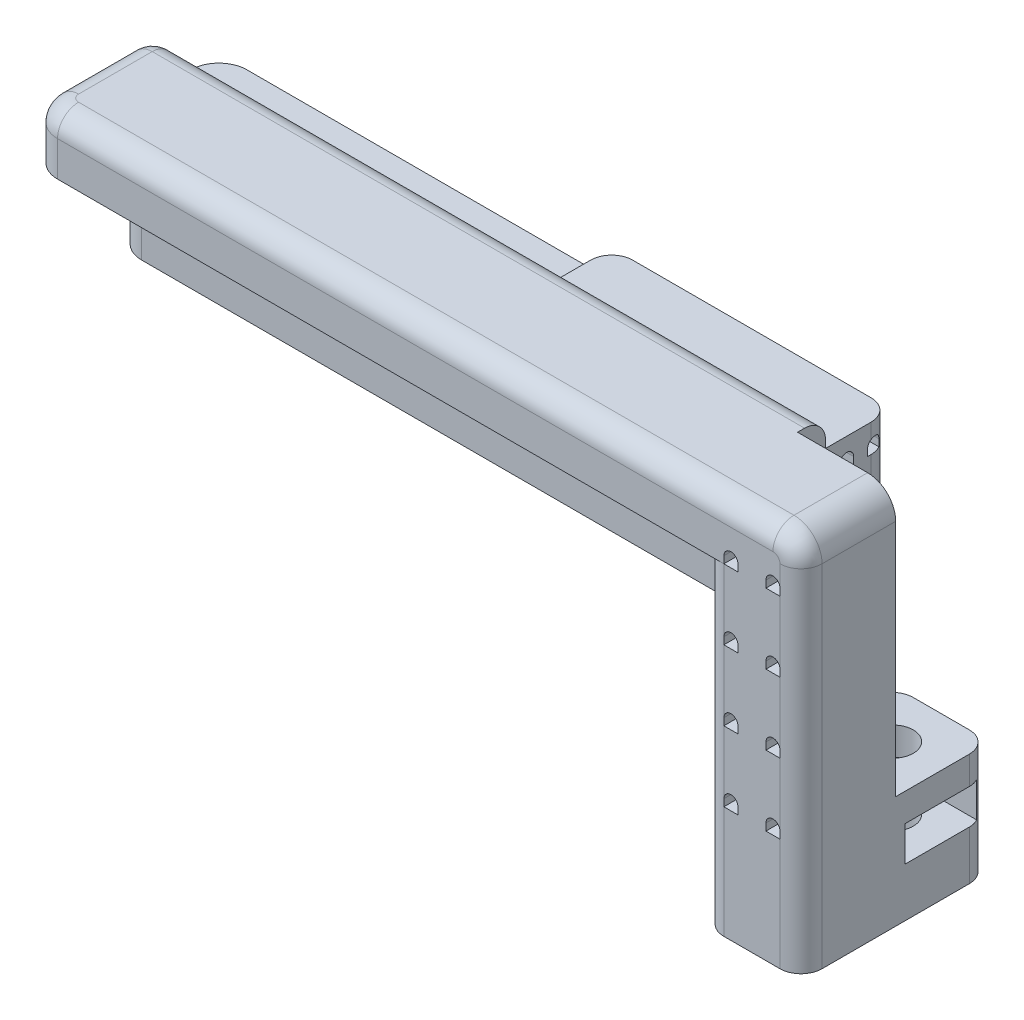
from build123d import *

# Parameters (mm, degrees)
SKETCH1_W            = 55
SKETCH1_H            = 16
BOSS_EXTRUDE1_DEPTH  = 4
SKETCH2_W            = 50
SKETCH2_H            = 8
BOSS_EXTRUDE2_DEPTH  = 8
SKETCH3_W            = 5
SKETCH3_H            = 16
BOSS_EXTRUDE3_DEPTH  = 28
SKETCH4_R            = 1.45
CUT_EXTRUDE2_DEPTH   = 10
CUT_EXTRUDE4_START   = -3
CUT_EXTRUDE4_DEPTH   = 3
CUT_EXTRUDE5_DEPTH   = 5
SKETCH8_W            = 50
SKETCH8_H            = 2
CUT_EXTRUDE6_DEPTH   = 4
CUT_EXTRUDE7_START   = -50
SKETCH9_W            = 0.5
SKETCH9_H            = 8
CUT_EXTRUDE7_DEPTH   = 50
CUT_EXTRUDE8_START   = -55
SKETCH10_W           = 0.5
SKETCH10_H           = 32
CUT_EXTRUDE8_DEPTH   = 55
CUT_EXTRUDE9_DEPTH   = 3
CUT_EXTRUDE11_DEPTH  = 3
BOSS_EXTRUDE4_START  = 2
SKETCH17_W           = 15
SKETCH17_H           = 32
BOSS_EXTRUDE4_DEPTH  = 2
CUT_EXTRUDE12_START  = -32
SKETCH18_W           = 7
SKETCH18_H           = 1.5
CUT_EXTRUDE12_DEPTH  = 32
FILLET1_R            = 2
SKETCH19_W           = 13.5
SKETCH19_H           = 32
CUT_EXTRUDE13_DEPTH  = 7
SKETCH20_W           = 7
SKETCH20_H           = 13.5
BOSS_EXTRUDE5_DEPTH  = 32
CUT_EXTRUDE14_DEPTH  = 13.5
FILLET2_R            = 2
CUT_EXTRUDE15_REACH  = 65.285
SKETCH22_W           = 6.75
SKETCH22_H           = 32
LPATTERN1_COUNT      = 4
LPATTERN1_PITCH      = 5
SKETCH23_W           = 4.75
SKETCH23_H           = 4
CUT_EXTRUDE16_DEPTH  = 48
BOSS_EXTRUDE9_START  = -15
SKETCH29_W           = 7
SKETCH29_H           = 6.75
SKETCH29_R           = 1.45
BOSS_EXTRUDE9_DEPTH  = 8
CUT_EXTRUDE19_START  = -2
CUT_EXTRUDE19_DEPTH  = 2.5
BOSS_EXTRUDE11_DEPTH = 20
SKETCH35_W           = 7
SKETCH35_H           = 5
CUT_EXTRUDE20_DEPTH  = 6.75
FILLET3_R            = 1.5


# Read off the part's stored shape, not the designer's step: Cut-Extrude4
with BuildPart() as part:
    # Sketch1 → Boss-Extrude1 (new body)
    with BuildSketch(Plane(origin=(0, 0, 0), x_dir=(1, 0, 0), z_dir=(0, 1, 0))):
        with Locations((27.5, 8)):
            Rectangle(SKETCH1_W, SKETCH1_H)
    extrude(amount=BOSS_EXTRUDE1_DEPTH)

    # Sketch2 → Boss-Extrude2 (add)
    with BuildSketch(Plane.XZ):
        with Locations((25, -10)):
            Rectangle(SKETCH2_W, SKETCH2_H)
    extrude(amount=BOSS_EXTRUDE2_DEPTH)

    # Sketch3 → Boss-Extrude3 (add)
    with BuildSketch(Plane.XZ):
        with Locations((52.5, -8)):
            Rectangle(SKETCH3_W, SKETCH3_H)
    extrude(amount=BOSS_EXTRUDE3_DEPTH)

    # Sketch4 → Cut-Extrude2 (cut)
    with BuildSketch(Plane.XY.offset(-6)):
        with Locations((10, -4)):
            Circle(SKETCH4_R)
        with Locations((20, -4)):
            Circle(SKETCH4_R)
        with Locations((30, -4)):
            Circle(SKETCH4_R)
        with Locations((40, -4)):
            Circle(SKETCH4_R)
    extrude(amount=-CUT_EXTRUDE2_DEPTH, mode=Mode.SUBTRACT)

    # Cut-Extrude4 outline → Cut-Extrude4 (cut)
    with BuildSketch(Plane.ZY.offset(-50).offset(CUT_EXTRUDE4_START)):
        Polygon((-6.598076211, -25.5), (-4, -27), (-1.401923789, -25.5), (-1.401923789, 0), (-6, 0), (-6, -8), (-6.598076211, -8), align=None)
        Polygon((-7.401923789, -25.5), (-7.401923789, -8), (-12.598076211, -8), (-12.598076211, -25.5), (-10, -27), align=None)
    extrude(amount=CUT_EXTRUDE4_DEPTH, mode=Mode.SUBTRACT)

    # Sketch7 → Cut-Extrude5 (cut)
    with BuildSketch(Plane.ZY.offset(-50)):
        with BuildLine():
            Line((-11.45, -12), (-11.45, -24))
            ThreePointArc((-11.45, -24), (-10, -25.45), (-8.55, -24))
            Line((-8.55, -24), (-8.55, -12))
            ThreePointArc((-8.55, -12), (-10, -10.55), (-11.45, -12))
        make_face()
        with BuildLine():
            Line((-2.55, -12), (-2.55, -24))
            ThreePointArc((-2.55, -24), (-4, -25.45), (-5.45, -24))
            Line((-5.45, -24), (-5.45, -12))
            ThreePointArc((-5.45, -12), (-4, -10.55), (-2.55, -12))
        make_face()
    extrude(amount=-CUT_EXTRUDE5_DEPTH, mode=Mode.SUBTRACT)

    # Sketch8 → Cut-Extrude6 (cut)
    with BuildSketch(Plane(origin=(0, 4, 0), x_dir=(1, 0, 0), z_dir=(0, 1, 0))):
        with Locations((25, 15)):
            Rectangle(SKETCH8_W, SKETCH8_H)
    extrude(amount=-CUT_EXTRUDE6_DEPTH, mode=Mode.SUBTRACT)

    # Sketch9 → Cut-Extrude7 (cut)
    with BuildSketch(Plane.ZY.offset(CUT_EXTRUDE7_START)):
        with Locations((-6.25, -4)):
            Rectangle(SKETCH9_W, SKETCH9_H)
    extrude(amount=CUT_EXTRUDE7_DEPTH, mode=Mode.SUBTRACT)

    # Sketch10 → Cut-Extrude8 (cut)
    with BuildSketch(Plane.ZY.offset(CUT_EXTRUDE8_START)):
        with Locations((-0.25, -12)):
            Rectangle(SKETCH10_W, SKETCH10_H)
        with Locations((-15.75, -12)):
            Rectangle(SKETCH10_W, SKETCH10_H)
    extrude(amount=CUT_EXTRUDE8_DEPTH, mode=Mode.SUBTRACT)

    # Sketch11 → Cut-Extrude9 (cut)
    with BuildSketch(Plane(origin=(0, 0, -14), x_dir=(-1, 0, 0), z_dir=(0, 0, -1))):
        Polygon((-37, -4), (-38.5, -1.401923789), (-41.5, -1.401923789), (-43, -4), (-41.5, -6.598076211), (-38.5, -6.598076211), align=None)
        Polygon((-27, -4), (-28.5, -1.401923789), (-31.5, -1.401923789), (-33, -4), (-31.5, -6.598076211), (-28.5, -6.598076211), align=None)
        Polygon((-17, -4), (-18.5, -1.401923789), (-21.5, -1.401923789), (-23, -4), (-21.5, -6.598076211), (-18.5, -6.598076211), align=None)
        Polygon((-7, -4), (-8.5, -1.401923789), (-11.5, -1.401923789), (-13, -4), (-11.5, -6.598076211), (-8.5, -6.598076211), align=None)
    extrude(amount=-CUT_EXTRUDE9_DEPTH, mode=Mode.SUBTRACT)

    # Sketch15 → Cut-Extrude11 (cut)
    with BuildSketch(Plane.ZY.offset(-50)):
        Polygon((-4, -27), (-1.401923789, -25.5), (-1.401923789, 0.004821093), (-1.401923789, 4), (-6.598076211, 4), (-6.598076211, -8), (-6.598076211, -25.5), align=None)
        Polygon((-7.401923789, -25.5), (-7.401923789, -8), (-7.401923789, 4), (-12.598076211, 4), (-12.598076211, -8), (-12.598076211, -25.5), (-10, -27), align=None)
    extrude(amount=-CUT_EXTRUDE11_DEPTH, mode=Mode.SUBTRACT)

    # Sketch17 → Boss-Extrude4 (add)
    with BuildSketch(Plane.ZY.offset(-50).offset(BOSS_EXTRUDE4_START)):
        with Locations((-8, -12)):
            Rectangle(SKETCH17_W, SKETCH17_H)
        with BuildLine():
            Line((-11.45, -12), (-11.45, -24))
            ThreePointArc((-11.45, -24), (-10, -25.45), (-8.55, -24))
            Line((-8.55, -24), (-8.55, -12))
            ThreePointArc((-8.55, -12), (-10, -10.55), (-11.45, -12))
        make_face(mode=Mode.SUBTRACT)
        with BuildLine():
            Line((-5.45, -12), (-5.45, -24))
            ThreePointArc((-5.45, -24), (-4, -25.45), (-2.55, -24))
            Line((-2.55, -24), (-2.55, -12))
            ThreePointArc((-2.55, -12), (-4, -10.55), (-5.45, -12))
        make_face(mode=Mode.SUBTRACT)
    extrude(amount=-BOSS_EXTRUDE4_DEPTH)

    # Sketch18 → Cut-Extrude12 (cut)
    with BuildSketch(Plane(origin=(0, 4, 0), x_dir=(1, 0, 0), z_dir=(0, 1, 0)).offset(CUT_EXTRUDE12_START)):
        with Locations((51.5, 14.75)):
            Rectangle(SKETCH18_W, SKETCH18_H)
    extrude(amount=CUT_EXTRUDE12_DEPTH, mode=Mode.SUBTRACT)

    # Fillet1
    fillet1_edges = [part.edges().sort_by_distance(p)[0] for p in [
        (0, -2, -14),
        (0, -4, -6.5),
        (0, 2, -0.5),
        (55, -12, -0.5),
        (48, -14, -0.5),
        (55, -12, -14),
        (48, -18, -14),
    ]]
    fillet(fillet1_edges, radius=FILLET1_R)

    # Sketch19 → Cut-Extrude13 (cut)
    with BuildSketch(Plane(origin=(55, 0, 0), x_dir=(0, 0, -1), z_dir=(1, 0, 0))):
        with Locations((7.25, -12)):
            Rectangle(SKETCH19_W, SKETCH19_H)
    extrude(amount=-CUT_EXTRUDE13_DEPTH, mode=Mode.SUBTRACT)

    # Sketch20 → Boss-Extrude5 (add)
    with BuildSketch(Plane(origin=(0, 4, 0), x_dir=(1, 0, 0), z_dir=(0, 1, 0))):
        with Locations((51.5, 7.25)):
            Rectangle(SKETCH20_W, SKETCH20_H)
    extrude(amount=-BOSS_EXTRUDE5_DEPTH)

    # Sketch21 → Cut-Extrude14 (cut)
    with BuildSketch(Plane.XY.offset(-0.5)):
        with BuildLine():
            Line((52.5, 0.5), (52.5, 0))
            Line((52.5, 0), (53.5, 0))
            Line((53.5, 0), (53.5, 0.5))
            ThreePointArc((53.5, 0.5), (53.353553391, 0.853553391), (53, 1))
            ThreePointArc((53, 1), (52.646446609, 0.853553391), (52.5, 0.5))
        make_face()
        with BuildLine():
            Line((49.5, 0.5), (49.5, 0))
            Line((49.5, 0), (50.5, 0))
            Line((50.5, 0), (50.5, 0.5))
            ThreePointArc((50.5, 0.5), (50, 1), (49.5, 0.5))
        make_face()
    cut_extrude14 = extrude(amount=-CUT_EXTRUDE14_DEPTH, mode=Mode.SUBTRACT)

    # Fillet2
    fillet2_edges = [part.edges().sort_by_distance(p)[0] for p in [
        (48, -28, -7.25),
        (55, -28, -7.25),
        (55, 4, -7.25),
    ]]
    fillet(fillet2_edges, radius=FILLET2_R)

    # Cut-Extrude15: up to this face of the body (flat: up to its plane)
    cut_extrude15_end = Plane(part.part.faces().sort_by_distance((48, -14.855670103, -6.631443299))[0])
    # Sketch22 → Cut-Extrude15 (cut, up to the picked face)
    with BuildSketch(Plane(origin=(55, 0, 0), x_dir=(0, 0, -1), z_dir=(1, 0, 0)), mode=Mode.PRIVATE) as cut_extrude15_sk1:
        with Locations((10.625, -12)):
            Rectangle(SKETCH22_W, SKETCH22_H)
    cut_extrude15_tool1 = split(extrude(cut_extrude15_sk1.sketch, amount=-CUT_EXTRUDE15_REACH, mode=Mode.PRIVATE), bisect_by=cut_extrude15_end, keep=Keep.BOTH, mode=Mode.PRIVATE)
    add(cut_extrude15_tool1.solids().sort_by(Axis((55, -12, -10.625), (-1, 0, 0)))[0], mode=Mode.SUBTRACT)

    # LPattern1: Cut-Extrude14 ×4
    with Locations(*[(0, -i * LPATTERN1_PITCH, 0) for i in range(1, LPATTERN1_COUNT)]):
        add(cut_extrude14, mode=Mode.SUBTRACT)

    # Sketch23 → Cut-Extrude16 (cut)
    with BuildSketch(Plane(origin=(48, 0, 0), x_dir=(0, 0, -1), z_dir=(1, 0, 0))):
        with Locations((11.625, 2)):
            Rectangle(SKETCH23_W, SKETCH23_H)
    extrude(amount=-CUT_EXTRUDE16_DEPTH, mode=Mode.SUBTRACT)

    # Sketch29 → Boss-Extrude9 (add)
    with BuildSketch(Plane(origin=(0, 0, 0), x_dir=(1, 0, 0), z_dir=(0, 1, 0)).offset(BOSS_EXTRUDE9_START)):
        with Locations((51.5, 10.625)):
            Rectangle(SKETCH29_W, SKETCH29_H)
        with Locations(Location((51.5, 10.55, 0), (0, 0, 270))):
            Circle(SKETCH29_R, mode=Mode.SUBTRACT)
    extrude(amount=-BOSS_EXTRUDE9_DEPTH)

    # Sketch30 → Cut-Extrude19 (cut)
    with BuildSketch(Plane(origin=(0, -15, 0), x_dir=(1, 0, 0), z_dir=(0, 1, 0)).offset(CUT_EXTRUDE19_START)):
        Polygon((53.029978213, 13.2), (49.970021787, 13.2), (48.440043573, 10.55), (49.970021787, 7.9), (53.029978213, 7.9), (55, 7.9), (55, 13.2), align=None)
    extrude(amount=-CUT_EXTRUDE19_DEPTH, mode=Mode.SUBTRACT)

    # Sketch34 → Boss-Extrude11 (add)
    with BuildSketch(Plane(origin=(48, 0, 0), x_dir=(0, 0, -1), z_dir=(1, 0, 0))):
        with BuildLine():
            Line((14, 0), (13.25, 0))
            Line((13.25, 0), (13.25, 0.5))
            ThreePointArc((13.25, 0.5), (12.75, 1), (12.25, 0.5))
            Line((12.25, 0.5), (12.25, 0))
            Line((12.25, 0), (11.25, 0))
            Line((11.25, 0), (11.25, 0.5))
            ThreePointArc((11.25, 0.5), (10.75, 1), (10.25, 0.5))
            Line((10.25, 0.5), (10.25, 0))
            Line((10.25, 0), (9.25, 0))
            Line((9.25, 0), (9.25, 2))
            Line((9.25, 2), (14, 2))
            Line((14, 2), (14, 0))
        make_face()
    extrude(amount=-BOSS_EXTRUDE11_DEPTH)

    # Sketch35 → Cut-Extrude20 (cut)
    with BuildSketch(Plane.XY.offset(-0.5)):
        with Locations((51.5, -25.5)):
            Rectangle(SKETCH35_W, SKETCH35_H)
    extrude(amount=-CUT_EXTRUDE20_DEPTH, mode=Mode.SUBTRACT)

    # Fillet3
    # the kernel refuses this fillet: 1.5 mm, written as the material it takes off along each edge
    with BuildSketch(Plane(origin=(1.5, 2.5, -7.75), x_dir=(0, 0, -1), z_dir=(0, 1, 0))) as fillet3_piece_1_section:
        Polygon((0, 0), (FILLET3_R, 0), (FILLET3_R, FILLET3_R), (0, FILLET3_R), align=None)
    fillet3_piece_1 = extrude(amount=FILLET3_R, mode=Mode.PRIVATE)
    fillet3_piece_1 = fillet3_piece_1 - Plane(origin=(1.5, 2.5, -7.75), x_dir=(0.7071067811865475, 0, 0.7071067811865475), z_dir=(0, 1, 0)) * Sphere(FILLET3_R, mode=Mode.PRIVATE)
    add(fillet3_piece_1, mode=Mode.SUBTRACT)
    with BuildSketch(Plane(origin=(0, 4, -7.75), x_dir=(1, 0, 0), z_dir=(0, 0, 1))) as fillet3_piece_2:
        with BuildLine():
            CenterArc((FILLET3_R, -FILLET3_R), FILLET3_R, 90, 90)
            Line((0, -FILLET3_R), (0, 0))
            Line((0, 0), (FILLET3_R, 0))
        make_face()
    extrude(amount=5.25, mode=Mode.SUBTRACT)
    with BuildSketch(Plane(origin=(2, 4, -2.5), x_dir=(-1, 0, 0), z_dir=(0, 0, -1))) as fillet3_piece_3:
        with BuildLine():
            CenterArc((2 - FILLET3_R, -FILLET3_R), FILLET3_R, 0, 90)
            Line((2, -FILLET3_R), (2, 0))
            Line((2, 0), (2 - FILLET3_R, 0))
        make_face()
    revolve(axis=Axis((2, 4, -2.5), (0, 1, 0)), revolution_arc=90, mode=Mode.SUBTRACT)
    with BuildSketch(Plane(origin=(2, 4, -0.5), x_dir=(0, 0, -1), z_dir=(1, 0, 0))) as fillet3_piece_4:
        with BuildLine():
            CenterArc((FILLET3_R, -FILLET3_R), FILLET3_R, 90, 90)
            Line((0, -FILLET3_R), (0, 0))
            Line((0, 0), (FILLET3_R, 0))
        make_face()
    extrude(amount=51, mode=Mode.SUBTRACT)
    with BuildSketch(Plane(origin=(53, 2, -0.5), x_dir=(0, 1, 0), z_dir=(-1, 0, 0))) as fillet3_piece_5:
        with BuildLine():
            CenterArc((2 - FILLET3_R, FILLET3_R), FILLET3_R, 270, 90)
            Line((2 - FILLET3_R, 0), (2, 0))
            Line((2, 0), (2, FILLET3_R))
        make_face()
    revolve(axis=Axis((53, 2, -0.5), (0, 0, -1)), revolution_arc=90, mode=Mode.SUBTRACT)
    with BuildSketch(Plane(origin=(28, 5.75, -14), x_dir=(1, 0, 0), z_dir=(0, -1, 0))) as fillet3_piece_6:
        with BuildLine():
            CenterArc((FILLET3_R, FILLET3_R), FILLET3_R, 180, 90)
            Line((0, FILLET3_R), (0, 0))
            Line((0, 0), (FILLET3_R, 0))
        make_face()
    extrude(amount=5.75, mode=Mode.SUBTRACT)
    with BuildSketch(Plane(origin=(48, -11.75, -14), x_dir=(-1, 0, 0), z_dir=(0, 1, 0))) as fillet3_piece_7:
        with BuildLine():
            CenterArc((FILLET3_R, FILLET3_R), FILLET3_R, 180, 90)
            Line((0, FILLET3_R), (0, 0))
            Line((0, 0), (FILLET3_R, 0))
        make_face()
    extrude(amount=17.5, mode=Mode.SUBTRACT)
    with BuildSketch(Plane(origin=(48, -11.25, -14), x_dir=(0, 0, 1), z_dir=(0, -1, 0))) as fillet3_piece_8:
        with BuildLine():
            CenterArc((FILLET3_R, -FILLET3_R), FILLET3_R, 90, 90)
            Line((0, -FILLET3_R), (0, 0))
            Line((0, 0), (FILLET3_R, 0))
        make_face()
    extrude(amount=15.5, mode=Mode.SUBTRACT)
    with BuildSketch(Plane(origin=(55, -11.25, -14), x_dir=(0, 0, 1), z_dir=(0, -1, 0))) as fillet3_piece_9:
        with BuildLine():
            CenterArc((FILLET3_R, FILLET3_R), FILLET3_R, 180, 90)
            Line((0, FILLET3_R), (0, 0))
            Line((0, 0), (FILLET3_R, 0))
        make_face()
    extrude(amount=15.5, mode=Mode.SUBTRACT)
    with BuildSketch(Plane(origin=(55, 2, -0.5), x_dir=(0, 0, -1), z_dir=(0, -1, 0))) as fillet3_piece_10:
        with BuildLine():
            CenterArc((FILLET3_R, -FILLET3_R), FILLET3_R, 90, 90)
            Line((0, -FILLET3_R), (0, 0))
            Line((0, 0), (FILLET3_R, 0))
        make_face()
    extrude(amount=28.75, mode=Mode.SUBTRACT)
    with BuildSketch(Plane(origin=(51.75, 4, -9.25), x_dir=(0, 0, 1), z_dir=(-1, 0, 0))) as fillet3_piece_11:
        with BuildLine():
            CenterArc((FILLET3_R, -FILLET3_R), FILLET3_R, 90, 90)
            Line((0, -FILLET3_R), (0, 0))
            Line((0, 0), (FILLET3_R, 0))
        make_face()
    extrude(amount=50.25, mode=Mode.SUBTRACT)
    with BuildSketch(Plane(origin=(0, 0, -9.25), x_dir=(1, 0, 0), z_dir=(0, 1, 0))) as fillet3_piece_12:
        with BuildLine():
            CenterArc((FILLET3_R, -FILLET3_R), FILLET3_R, 90, 90)
            Line((0, -FILLET3_R), (0, 0))
            Line((0, 0), (FILLET3_R, 0))
        make_face()
    extrude(amount=2.5, mode=Mode.SUBTRACT)
    with BuildSketch(Plane(origin=(48, 0, -0.5), x_dir=(0, 0, -1), z_dir=(0, -1, 0))) as fillet3_piece_13:
        with BuildLine():
            CenterArc((FILLET3_R, FILLET3_R), FILLET3_R, 180, 90)
            Line((0, FILLET3_R), (0, 0))
            Line((0, 0), (FILLET3_R, 0))
        make_face()
    extrude(amount=26.75, mode=Mode.SUBTRACT)


solid = part.part
